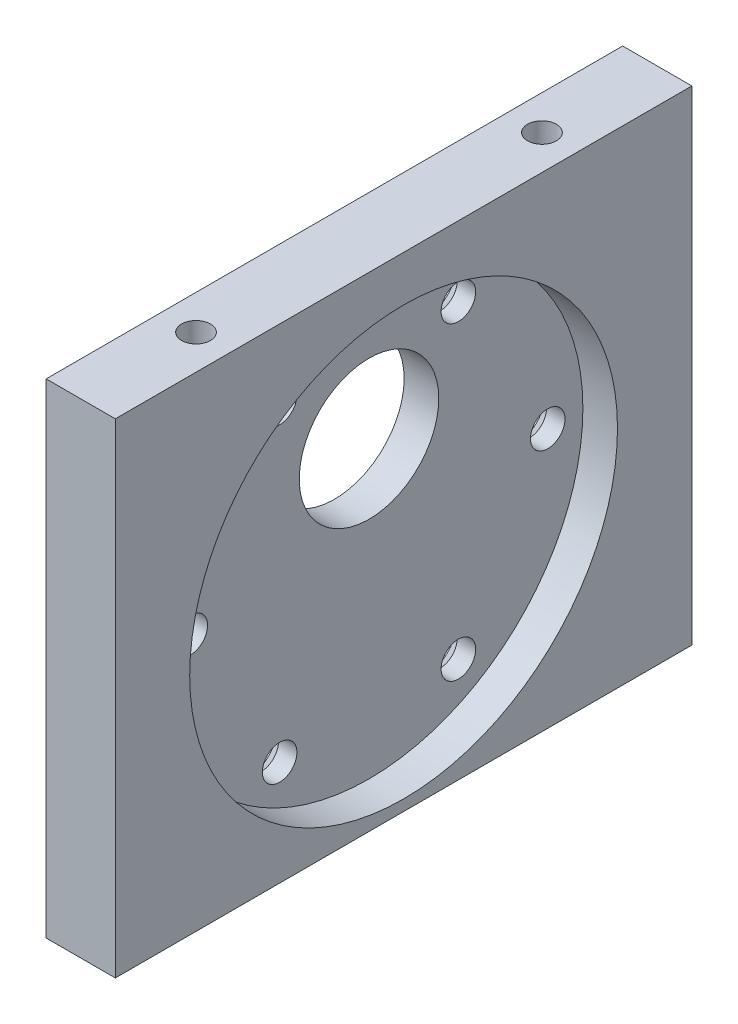
from build123d import *

# Parameters (mm, degrees)
SKETCH1_W                   = 6
SKETCH1_H                   = 50
BOSS_EXTRUDE1_DEPTH         = 42
TAP_DRILL_FOR_M3_TAP1_D     = 2.5
TAP_DRILL_FOR_M3_TAP1_DEPTH = 10
TAP_DRILL_FOR_M3_TAP1_TIP   = 0.751075774
TAP_DRILL_FOR_M3_TAP2_D     = 2.5
TAP_DRILL_FOR_M3_TAP2_DEPTH = 7
TAP_DRILL_FOR_M3_TAP2_TIP   = 0.751075774
SKETCH6_R                   = 18.55
CUT_EXTRUDE1_DEPTH          = 3
CUT_EXTRUDE2_REACH          = 67.368
SKETCH7_R                   = 6.05
SKETCH7_R_2                 = 1.5
CIRPATTERN1_OUTLINE_R       = 1.5
CIRPATTERN1_DEPTH           = 3
CHAMFER1_SIZE               = 1.4


# Read off the part's stored shape, not the designer's step: CirPattern1
with BuildPart() as part:
    # Sketch1 → Boss-Extrude1 (new body)
    with BuildSketch(Plane(origin=(0, 0, 0), x_dir=(1, 0, 0), z_dir=(0, 1, 0))):
        with Locations((3, 25)):
            Rectangle(SKETCH1_W, SKETCH1_H)
    extrude(amount=BOSS_EXTRUDE1_DEPTH)

    # Tap Drill for M3 Tap1
    with Locations(Plane(origin=(0, 42, 0), x_dir=(-1, 0, 0), z_dir=(0, 1, 0))):
        with Locations((-3, -10), (-3, -40)):
            Hole(TAP_DRILL_FOR_M3_TAP1_D / 2, depth=TAP_DRILL_FOR_M3_TAP1_DEPTH)
            with Locations((0, 0, -(TAP_DRILL_FOR_M3_TAP1_DEPTH + TAP_DRILL_FOR_M3_TAP1_TIP / 2))):  # 118° drill point
                Cone(0, TAP_DRILL_FOR_M3_TAP1_D / 2, TAP_DRILL_FOR_M3_TAP1_TIP, mode=Mode.SUBTRACT)

    # Tap Drill for M3 Tap2
    with Locations(Plane.XZ):
        with Locations((3, -10), (3, -40)):
            Hole(TAP_DRILL_FOR_M3_TAP2_D / 2, depth=TAP_DRILL_FOR_M3_TAP2_DEPTH)
            with Locations((0, 0, -(TAP_DRILL_FOR_M3_TAP2_DEPTH + TAP_DRILL_FOR_M3_TAP2_TIP / 2))):  # 118° drill point
                Cone(0, TAP_DRILL_FOR_M3_TAP2_D / 2, TAP_DRILL_FOR_M3_TAP2_TIP, mode=Mode.SUBTRACT)

    # Sketch6 → Cut-Extrude1 (cut)
    with BuildSketch(Plane(origin=(6, 0, 0), x_dir=(0, 0, -1), z_dir=(1, 0, 0))):
        with Locations((25, 19.5)):
            Circle(SKETCH6_R)
    extrude(amount=-CUT_EXTRUDE1_DEPTH, mode=Mode.SUBTRACT)

    # Sketch7 → Cut-Extrude2 (cut, up to next)
    with BuildSketch(Plane(origin=(3, 0, 0), x_dir=(0, 0, -1), z_dir=(1, 0, 0)), mode=Mode.PRIVATE) as cut_extrude2_sk1:
        with Locations((25, 26.5)):
            Circle(SKETCH7_R)
    cut_extrude2_tool1 = extrude(cut_extrude2_sk1.sketch, amount=-CUT_EXTRUDE2_REACH, mode=Mode.PRIVATE) & part.part
    # Sketch7 → Cut-Extrude2 (cut, up to next)
    with BuildSketch(Plane(origin=(3, 0, 0), x_dir=(0, 0, -1), z_dir=(1, 0, 0)), mode=Mode.PRIVATE) as cut_extrude2_sk2:
        with Locations((9.5, 19.5)):
            Circle(SKETCH7_R_2)
    cut_extrude2_tool2 = extrude(cut_extrude2_sk2.sketch, amount=-CUT_EXTRUDE2_REACH, mode=Mode.PRIVATE) & part.part
    add(cut_extrude2_tool1.solids().sort_by_distance((3, 26.5, -25))[0], mode=Mode.SUBTRACT)
    add(cut_extrude2_tool2.solids().sort_by_distance((3, 19.5, -9.5))[0], mode=Mode.SUBTRACT)

    # CirPattern1 outline → CirPattern1 (cut)
    with BuildSketch(Plane.YZ):
        with Locations((32.923393759, -17.25)):
            Circle(CIRPATTERN1_OUTLINE_R)
        with Locations((32.923393759, -32.75)):
            Circle(CIRPATTERN1_OUTLINE_R)
        with Locations((19.5, -40.5)):
            Circle(CIRPATTERN1_OUTLINE_R)
        with Locations((6.076606241, -32.75)):
            Circle(CIRPATTERN1_OUTLINE_R)
        with Locations((6.076606241, -17.25)):
            Circle(CIRPATTERN1_OUTLINE_R)
    extrude(amount=CIRPATTERN1_DEPTH, mode=Mode.SUBTRACT)

    # Chamfer1
    chamfer1_edges = [part.edges().sort_by_distance(p)[0] for p in [
        (0, 19.5, -8),
        (0, 4.576606241, -17.25),
        (0, 4.576606241, -32.75),
        (0, 18, -40.5),
        (0, 31.423393759, -32.75),
        (0, 31.423393759, -17.25),
    ]]
    chamfer(chamfer1_edges, length=CHAMFER1_SIZE)


solid = part.part
